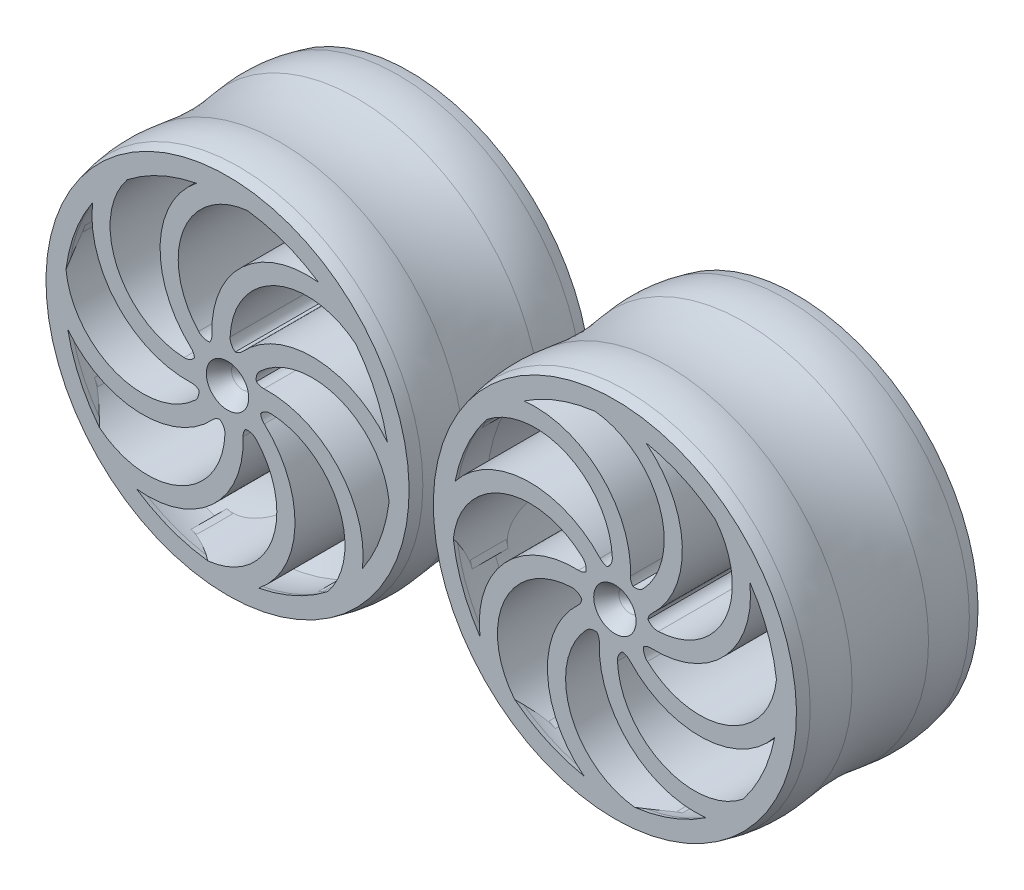
from build123d import *

# Parameters (mm, degrees)
SKETCH1_W                       = 15
SKETCH1_H                       = 2
BOSS_EXTRUDE1_REACH             = 25.052
BOSS_EXTRUDE1_DIRECTION_2_REACH = 25.052
FILLET3_R                       = 1
FILLET4_R                       = 10
CHAMFER4_SIZE                   = 1
CHAMFER4_SIZE2                  = 1.5
FILLET9_R                       = 1


with BuildPart() as part:
    # Sketch1 → Revolve1 (revolve)
    with BuildSketch(Plane(origin=(0, 0, 0), x_dir=(0, 0, -1), z_dir=(1, 0, 0)), mode=Mode.PRIVATE) as revolve1_sk:
        with Locations((0, 1.75)):
            Rectangle(SKETCH1_W, SKETCH1_H)
        with BuildLine():
            Line((-7.5, 15), (-7.5, 13.44651309))
            Line((-7.5, 13.44651309), (-7.109783666, 13.551645343))
            ThreePointArc((-7.109783666, 13.551645343), (-5.652360719, 13.835575666), (-4.169459433, 13.911086274))
            ThreePointArc((-4.169459433, 13.911086274), (0, 13.5), (4.169459433, 13.911086274))
            ThreePointArc((4.169459433, 13.911086274), (5.652360719, 13.835575666), (7.109783666, 13.551645343))
            Line((7.109783666, 13.551645343), (7.5, 13.44651309))
            Line((7.5, 13.44651309), (7.5, 15))
            ThreePointArc((7.5, 15), (5.765027363, 15.332764338), (4, 15.407199276))
            ThreePointArc((4, 15.407199276), (0, 15), (-4, 15.407199276))
            ThreePointArc((-4, 15.407199276), (-5.765027363, 15.332764338), (-7.5, 15))
        make_face()
    revolve(revolve1_sk.sketch.rotate(Axis((0, 0, 7.5), (0, 0, -1)), 180), axis=Axis((0, 0, 7.5), (0, 0, -1)))

    # Boss-Extrude1: up to this face of the body (flat: up to its plane)
    boss_extrude1_end = Plane(part.part.faces().sort_by_distance((0, 13.870777159, -7.5))[0])
    # Sketch3 → Boss-Extrude1 (add, up to the picked face)
    with BuildSketch(Plane(origin=(0, 0, 0), x_dir=(-1, 0, 0), z_dir=(0, 0, -1)), mode=Mode.PRIVATE) as boss_extrude1_sk1:
        with BuildLine():
            ThreePointArc((6.203693612, -12.270969219), (8.854913119, -10.51917362), (11.033195249, -8.205553156))
            ThreePointArc((11.033195249, -8.205553156), (8.865009868, -0.982514478), (1.618423571, 1.10561929))
            ThreePointArc((1.618423571, 1.10561929), (1.336532687, 0.612387367), (1.099671353, 0.096018403))
            ThreePointArc((1.099671353, 0.096018403), (1.519817571, -0.120882453), (1.926189179, -0.362607385))
            ThreePointArc((1.926189179, -0.362607385), (9.327117725, -4.426605369), (6.203693635, -12.270969265))
        make_face()
    boss_extrude1_tool1 = split(extrude(boss_extrude1_sk1.sketch, amount=BOSS_EXTRUDE1_REACH, mode=Mode.PRIVATE), bisect_by=boss_extrude1_end, keep=Keep.BOTH, mode=Mode.PRIVATE)
    # Sketch3 → Boss-Extrude1 (add, up to the picked face)
    with BuildSketch(Plane(origin=(0, 0, 0), x_dir=(-1, 0, 0), z_dir=(0, 0, -1)), mode=Mode.PRIVATE) as boss_extrude1_sk2:
        with BuildLine():
            ThreePointArc((13.063559368, -4.290211725), (13.577305353, -2.172390238), (13.75, 0))
            ThreePointArc((13.75, 0), (13.71341369, 1.00238963), (13.603849459, 1.999444899))
            ThreePointArc((13.603849459, 1.999444899), (6.963251243, 5.573765943), (0.362607385, 1.926189179))
            ThreePointArc((0.362607385, 1.926189179), (0.512048066, 1.378094586), (0.709689807, 0.845480334))
            ThreePointArc((0.709689807, 0.845480334), (1.160150113, 0.989196508), (1.618423571, 1.10561929))
            ThreePointArc((1.618423571, 1.10561929), (9.725350867, 3.465185518), (13.063559416, -4.290211741))
        make_face()
    boss_extrude1_tool2 = split(extrude(boss_extrude1_sk2.sketch, amount=BOSS_EXTRUDE1_REACH, mode=Mode.PRIVATE), bisect_by=boss_extrude1_end, keep=Keep.BOTH, mode=Mode.PRIVATE)
    # Sketch3 → Boss-Extrude1 (add, up to the picked face)
    with BuildSketch(Plane(origin=(0, 0, 0), x_dir=(-1, 0, 0), z_dir=(0, 0, -1)), mode=Mode.PRIVATE) as boss_extrude1_sk3:
        with BuildLine():
            ThreePointArc((0.362607385, 1.926189179), (4.426605369, 9.327117725), (12.270969265, 6.203693635))
            ThreePointArc((12.270969219, 6.203693612), (10.51917362, 8.854913119), (8.205553156, 11.033195249))
            ThreePointArc((8.205553156, 11.033195249), (0.982514478, 8.865009868), (-1.10561929, 1.618423571))
            ThreePointArc((-1.10561929, 1.618423571), (-0.612387367, 1.336532687), (-0.096018403, 1.099671353))
            ThreePointArc((-0.096018403, 1.099671353), (0.120882453, 1.519817571), (0.362607385, 1.926189179))
        make_face()
    boss_extrude1_tool3 = split(extrude(boss_extrude1_sk3.sketch, amount=BOSS_EXTRUDE1_REACH, mode=Mode.PRIVATE), bisect_by=boss_extrude1_end, keep=Keep.BOTH, mode=Mode.PRIVATE)
    # Sketch3 → Boss-Extrude1 (add, up to the picked face)
    with BuildSketch(Plane(origin=(0, 0, 0), x_dir=(-1, 0, 0), z_dir=(0, 0, -1)), mode=Mode.PRIVATE) as boss_extrude1_sk4:
        with BuildLine():
            ThreePointArc((-1.10561929, 1.618423571), (-3.465185518, 9.725350867), (4.290211741, 13.063559416))
            ThreePointArc((4.290211725, 13.063559368), (1.176809886, 13.699548113), (-1.999444899, 13.603849459))
            ThreePointArc((-1.999444899, 13.603849459), (-5.573765943, 6.963251243), (-1.926189179, 0.362607385))
            ThreePointArc((-1.926189179, 0.362607385), (-1.378094586, 0.512048066), (-0.845480334, 0.709689807))
            ThreePointArc((-0.845480334, 0.709689807), (-0.989196508, 1.160150113), (-1.10561929, 1.618423571))
        make_face()
    boss_extrude1_tool4 = split(extrude(boss_extrude1_sk4.sketch, amount=BOSS_EXTRUDE1_REACH, mode=Mode.PRIVATE), bisect_by=boss_extrude1_end, keep=Keep.BOTH, mode=Mode.PRIVATE)
    # Sketch3 → Boss-Extrude1 (add, up to the picked face)
    with BuildSketch(Plane(origin=(0, 0, 0), x_dir=(-1, 0, 0), z_dir=(0, 0, -1)), mode=Mode.PRIVATE) as boss_extrude1_sk5:
        with BuildLine():
            ThreePointArc((-1.926189179, 0.362607385), (-9.327117725, 4.426605369), (-6.203693635, 12.270969265))
            ThreePointArc((-6.203693612, 12.270969219), (-8.854913119, 10.51917362), (-11.033195249, 8.205553156))
            ThreePointArc((-11.033195249, 8.205553156), (-8.865009868, 0.982514478), (-1.618423571, -1.10561929))
            ThreePointArc((-1.618423571, -1.10561929), (-1.336532687, -0.612387367), (-1.099671353, -0.096018403))
            ThreePointArc((-1.099671353, -0.096018403), (-1.519817571, 0.120882453), (-1.926189179, 0.362607385))
        make_face()
    boss_extrude1_tool5 = split(extrude(boss_extrude1_sk5.sketch, amount=BOSS_EXTRUDE1_REACH, mode=Mode.PRIVATE), bisect_by=boss_extrude1_end, keep=Keep.BOTH, mode=Mode.PRIVATE)
    # Sketch3 → Boss-Extrude1 (add, up to the picked face)
    with BuildSketch(Plane(origin=(0, 0, 0), x_dir=(-1, 0, 0), z_dir=(0, 0, -1)), mode=Mode.PRIVATE) as boss_extrude1_sk6:
        with BuildLine():
            ThreePointArc((-1.618423571, -1.10561929), (-9.725350867, -3.465185518), (-13.063559416, 4.290211741))
            ThreePointArc((-13.063559368, 4.290211725), (-13.699548113, 1.176809886), (-13.603849459, -1.999444899))
            ThreePointArc((-13.603849459, -1.999444899), (-6.963251243, -5.573765943), (-0.362607385, -1.926189179))
            ThreePointArc((-0.362607385, -1.926189179), (-0.512048066, -1.378094586), (-0.709689807, -0.845480334))
            ThreePointArc((-0.709689807, -0.845480334), (-1.160150113, -0.989196508), (-1.618423571, -1.10561929))
        make_face()
    boss_extrude1_tool6 = split(extrude(boss_extrude1_sk6.sketch, amount=BOSS_EXTRUDE1_REACH, mode=Mode.PRIVATE), bisect_by=boss_extrude1_end, keep=Keep.BOTH, mode=Mode.PRIVATE)
    # Sketch3 → Boss-Extrude1 (add, up to the picked face)
    with BuildSketch(Plane(origin=(0, 0, 0), x_dir=(-1, 0, 0), z_dir=(0, 0, -1)), mode=Mode.PRIVATE) as boss_extrude1_sk7:
        with BuildLine():
            ThreePointArc((-12.270969219, -6.203693612), (-10.51917362, -8.854913119), (-8.205553156, -11.033195249))
            ThreePointArc((-8.205553156, -11.033195249), (-0.982514478, -8.865009868), (1.10561929, -1.618423571))
            ThreePointArc((1.10561929, -1.618423571), (0.612387367, -1.336532687), (0.096018403, -1.099671353))
            ThreePointArc((0.096018403, -1.099671353), (-0.120882453, -1.519817571), (-0.362607385, -1.926189179))
            ThreePointArc((-0.362607385, -1.926189179), (-4.426605369, -9.327117725), (-12.270969265, -6.203693635))
        make_face()
    boss_extrude1_tool7 = split(extrude(boss_extrude1_sk7.sketch, amount=BOSS_EXTRUDE1_REACH, mode=Mode.PRIVATE), bisect_by=boss_extrude1_end, keep=Keep.BOTH, mode=Mode.PRIVATE)
    # Sketch3 → Boss-Extrude1 (add, up to the picked face)
    with BuildSketch(Plane(origin=(0, 0, 0), x_dir=(-1, 0, 0), z_dir=(0, 0, -1)), mode=Mode.PRIVATE) as boss_extrude1_sk8:
        with BuildLine():
            ThreePointArc((-4.290211725, -13.063559368), (-1.176809886, -13.699548113), (1.999444899, -13.603849459))
            ThreePointArc((1.999444899, -13.603849459), (5.573765943, -6.963251243), (1.926189179, -0.362607385))
            ThreePointArc((1.926189179, -0.362607385), (1.378094586, -0.512048066), (0.845480334, -0.709689807))
            ThreePointArc((0.845480334, -0.709689807), (0.989196508, -1.160150113), (1.10561929, -1.618423571))
            ThreePointArc((1.10561929, -1.618423571), (3.465185518, -9.725350867), (-4.290211741, -13.063559416))
        make_face()
    boss_extrude1_tool8 = split(extrude(boss_extrude1_sk8.sketch, amount=BOSS_EXTRUDE1_REACH, mode=Mode.PRIVATE), bisect_by=boss_extrude1_end, keep=Keep.BOTH, mode=Mode.PRIVATE)
    add(boss_extrude1_tool1.solids().sort_by(Axis((-8.745993, -10.389783, 0), (0, 0, -1)))[0])
    add(boss_extrude1_tool2.solids().sort_by(Axis((-13.413104, -2.146118, 0), (0, 0, -1)))[0])
    add(boss_extrude1_tool3.solids().sort_by(Axis((0.027007, 1.60188, 0), (0, 0, -1)))[0])
    add(boss_extrude1_tool4.solids().sort_by(Axis((1.149065, 1.114385, 0), (0, 0, -1)))[0])
    add(boss_extrude1_tool5.solids().sort_by(Axis((1.60188, -0.027007, 0), (0, 0, -1)))[0])
    add(boss_extrude1_tool6.solids().sort_by(Axis((1.114385, -1.149065, 0), (0, 0, -1)))[0])
    add(boss_extrude1_tool7.solids().sort_by(Axis((10.389783, -8.745993, 0), (0, 0, -1)))[0])
    add(boss_extrude1_tool8.solids().sort_by(Axis((1.162578, -13.533869, 0), (0, 0, -1)))[0])

    # Boss-Extrude1 direction 2: up to this face of the body (flat: up to its plane)
    boss_extrude1_direction_2_end = Plane(part.part.faces().sort_by_distance((0, 14.575735931, 7.5))[0])
    # Sketch3 → Boss-Extrude1 direction 2 (add, up to the picked face)
    with BuildSketch(Plane(origin=(0, 0, 0), x_dir=(-1, 0, 0), z_dir=(0, 0, -1)), mode=Mode.PRIVATE) as boss_extrude1_direction_2_sk1:
        with BuildLine():
            ThreePointArc((6.203693612, -12.270969219), (8.854913119, -10.51917362), (11.033195249, -8.205553156))
            ThreePointArc((11.033195249, -8.205553156), (8.865009868, -0.982514478), (1.618423571, 1.10561929))
            ThreePointArc((1.618423571, 1.10561929), (1.336532687, 0.612387367), (1.099671353, 0.096018403))
            ThreePointArc((1.099671353, 0.096018403), (1.519817571, -0.120882453), (1.926189179, -0.362607385))
            ThreePointArc((1.926189179, -0.362607385), (9.327117725, -4.426605369), (6.203693635, -12.270969265))
        make_face()
    boss_extrude1_direction_2_tool1 = split(extrude(boss_extrude1_direction_2_sk1.sketch, amount=-BOSS_EXTRUDE1_DIRECTION_2_REACH, mode=Mode.PRIVATE), bisect_by=boss_extrude1_direction_2_end, keep=Keep.BOTH, mode=Mode.PRIVATE)
    # Sketch3 → Boss-Extrude1 direction 2 (add, up to the picked face)
    with BuildSketch(Plane(origin=(0, 0, 0), x_dir=(-1, 0, 0), z_dir=(0, 0, -1)), mode=Mode.PRIVATE) as boss_extrude1_direction_2_sk2:
        with BuildLine():
            ThreePointArc((13.063559368, -4.290211725), (13.577305353, -2.172390238), (13.75, 0))
            ThreePointArc((13.75, 0), (13.71341369, 1.00238963), (13.603849459, 1.999444899))
            ThreePointArc((13.603849459, 1.999444899), (6.963251243, 5.573765943), (0.362607385, 1.926189179))
            ThreePointArc((0.362607385, 1.926189179), (0.512048066, 1.378094586), (0.709689807, 0.845480334))
            ThreePointArc((0.709689807, 0.845480334), (1.160150113, 0.989196508), (1.618423571, 1.10561929))
            ThreePointArc((1.618423571, 1.10561929), (9.725350867, 3.465185518), (13.063559416, -4.290211741))
        make_face()
    boss_extrude1_direction_2_tool2 = split(extrude(boss_extrude1_direction_2_sk2.sketch, amount=-BOSS_EXTRUDE1_DIRECTION_2_REACH, mode=Mode.PRIVATE), bisect_by=boss_extrude1_direction_2_end, keep=Keep.BOTH, mode=Mode.PRIVATE)
    # Sketch3 → Boss-Extrude1 direction 2 (add, up to the picked face)
    with BuildSketch(Plane(origin=(0, 0, 0), x_dir=(-1, 0, 0), z_dir=(0, 0, -1)), mode=Mode.PRIVATE) as boss_extrude1_direction_2_sk3:
        with BuildLine():
            ThreePointArc((0.362607385, 1.926189179), (4.426605369, 9.327117725), (12.270969265, 6.203693635))
            ThreePointArc((12.270969219, 6.203693612), (10.51917362, 8.854913119), (8.205553156, 11.033195249))
            ThreePointArc((8.205553156, 11.033195249), (0.982514478, 8.865009868), (-1.10561929, 1.618423571))
            ThreePointArc((-1.10561929, 1.618423571), (-0.612387367, 1.336532687), (-0.096018403, 1.099671353))
            ThreePointArc((-0.096018403, 1.099671353), (0.120882453, 1.519817571), (0.362607385, 1.926189179))
        make_face()
    boss_extrude1_direction_2_tool3 = split(extrude(boss_extrude1_direction_2_sk3.sketch, amount=-BOSS_EXTRUDE1_DIRECTION_2_REACH, mode=Mode.PRIVATE), bisect_by=boss_extrude1_direction_2_end, keep=Keep.BOTH, mode=Mode.PRIVATE)
    # Sketch3 → Boss-Extrude1 direction 2 (add, up to the picked face)
    with BuildSketch(Plane(origin=(0, 0, 0), x_dir=(-1, 0, 0), z_dir=(0, 0, -1)), mode=Mode.PRIVATE) as boss_extrude1_direction_2_sk4:
        with BuildLine():
            ThreePointArc((-1.10561929, 1.618423571), (-3.465185518, 9.725350867), (4.290211741, 13.063559416))
            ThreePointArc((4.290211725, 13.063559368), (1.176809886, 13.699548113), (-1.999444899, 13.603849459))
            ThreePointArc((-1.999444899, 13.603849459), (-5.573765943, 6.963251243), (-1.926189179, 0.362607385))
            ThreePointArc((-1.926189179, 0.362607385), (-1.378094586, 0.512048066), (-0.845480334, 0.709689807))
            ThreePointArc((-0.845480334, 0.709689807), (-0.989196508, 1.160150113), (-1.10561929, 1.618423571))
        make_face()
    boss_extrude1_direction_2_tool4 = split(extrude(boss_extrude1_direction_2_sk4.sketch, amount=-BOSS_EXTRUDE1_DIRECTION_2_REACH, mode=Mode.PRIVATE), bisect_by=boss_extrude1_direction_2_end, keep=Keep.BOTH, mode=Mode.PRIVATE)
    # Sketch3 → Boss-Extrude1 direction 2 (add, up to the picked face)
    with BuildSketch(Plane(origin=(0, 0, 0), x_dir=(-1, 0, 0), z_dir=(0, 0, -1)), mode=Mode.PRIVATE) as boss_extrude1_direction_2_sk5:
        with BuildLine():
            ThreePointArc((-1.926189179, 0.362607385), (-9.327117725, 4.426605369), (-6.203693635, 12.270969265))
            ThreePointArc((-6.203693612, 12.270969219), (-8.854913119, 10.51917362), (-11.033195249, 8.205553156))
            ThreePointArc((-11.033195249, 8.205553156), (-8.865009868, 0.982514478), (-1.618423571, -1.10561929))
            ThreePointArc((-1.618423571, -1.10561929), (-1.336532687, -0.612387367), (-1.099671353, -0.096018403))
            ThreePointArc((-1.099671353, -0.096018403), (-1.519817571, 0.120882453), (-1.926189179, 0.362607385))
        make_face()
    boss_extrude1_direction_2_tool5 = split(extrude(boss_extrude1_direction_2_sk5.sketch, amount=-BOSS_EXTRUDE1_DIRECTION_2_REACH, mode=Mode.PRIVATE), bisect_by=boss_extrude1_direction_2_end, keep=Keep.BOTH, mode=Mode.PRIVATE)
    # Sketch3 → Boss-Extrude1 direction 2 (add, up to the picked face)
    with BuildSketch(Plane(origin=(0, 0, 0), x_dir=(-1, 0, 0), z_dir=(0, 0, -1)), mode=Mode.PRIVATE) as boss_extrude1_direction_2_sk6:
        with BuildLine():
            ThreePointArc((-1.618423571, -1.10561929), (-9.725350867, -3.465185518), (-13.063559416, 4.290211741))
            ThreePointArc((-13.063559368, 4.290211725), (-13.699548113, 1.176809886), (-13.603849459, -1.999444899))
            ThreePointArc((-13.603849459, -1.999444899), (-6.963251243, -5.573765943), (-0.362607385, -1.926189179))
            ThreePointArc((-0.362607385, -1.926189179), (-0.512048066, -1.378094586), (-0.709689807, -0.845480334))
            ThreePointArc((-0.709689807, -0.845480334), (-1.160150113, -0.989196508), (-1.618423571, -1.10561929))
        make_face()
    boss_extrude1_direction_2_tool6 = split(extrude(boss_extrude1_direction_2_sk6.sketch, amount=-BOSS_EXTRUDE1_DIRECTION_2_REACH, mode=Mode.PRIVATE), bisect_by=boss_extrude1_direction_2_end, keep=Keep.BOTH, mode=Mode.PRIVATE)
    # Sketch3 → Boss-Extrude1 direction 2 (add, up to the picked face)
    with BuildSketch(Plane(origin=(0, 0, 0), x_dir=(-1, 0, 0), z_dir=(0, 0, -1)), mode=Mode.PRIVATE) as boss_extrude1_direction_2_sk7:
        with BuildLine():
            ThreePointArc((-12.270969219, -6.203693612), (-10.51917362, -8.854913119), (-8.205553156, -11.033195249))
            ThreePointArc((-8.205553156, -11.033195249), (-0.982514478, -8.865009868), (1.10561929, -1.618423571))
            ThreePointArc((1.10561929, -1.618423571), (0.612387367, -1.336532687), (0.096018403, -1.099671353))
            ThreePointArc((0.096018403, -1.099671353), (-0.120882453, -1.519817571), (-0.362607385, -1.926189179))
            ThreePointArc((-0.362607385, -1.926189179), (-4.426605369, -9.327117725), (-12.270969265, -6.203693635))
        make_face()
    boss_extrude1_direction_2_tool7 = split(extrude(boss_extrude1_direction_2_sk7.sketch, amount=-BOSS_EXTRUDE1_DIRECTION_2_REACH, mode=Mode.PRIVATE), bisect_by=boss_extrude1_direction_2_end, keep=Keep.BOTH, mode=Mode.PRIVATE)
    # Sketch3 → Boss-Extrude1 direction 2 (add, up to the picked face)
    with BuildSketch(Plane(origin=(0, 0, 0), x_dir=(-1, 0, 0), z_dir=(0, 0, -1)), mode=Mode.PRIVATE) as boss_extrude1_direction_2_sk8:
        with BuildLine():
            ThreePointArc((-4.290211725, -13.063559368), (-1.176809886, -13.699548113), (1.999444899, -13.603849459))
            ThreePointArc((1.999444899, -13.603849459), (5.573765943, -6.963251243), (1.926189179, -0.362607385))
            ThreePointArc((1.926189179, -0.362607385), (1.378094586, -0.512048066), (0.845480334, -0.709689807))
            ThreePointArc((0.845480334, -0.709689807), (0.989196508, -1.160150113), (1.10561929, -1.618423571))
            ThreePointArc((1.10561929, -1.618423571), (3.465185518, -9.725350867), (-4.290211741, -13.063559416))
        make_face()
    boss_extrude1_direction_2_tool8 = split(extrude(boss_extrude1_direction_2_sk8.sketch, amount=-BOSS_EXTRUDE1_DIRECTION_2_REACH, mode=Mode.PRIVATE), bisect_by=boss_extrude1_direction_2_end, keep=Keep.BOTH, mode=Mode.PRIVATE)
    add(boss_extrude1_direction_2_tool1.solids().sort_by(Axis((-8.745993, -10.389783, 0), (0, 0, 1)))[0])
    add(boss_extrude1_direction_2_tool2.solids().sort_by(Axis((-13.413104, -2.146118, 0), (0, 0, 1)))[0])
    add(boss_extrude1_direction_2_tool3.solids().sort_by(Axis((0.027007, 1.60188, 0), (0, 0, 1)))[0])
    add(boss_extrude1_direction_2_tool4.solids().sort_by(Axis((1.149065, 1.114385, 0), (0, 0, 1)))[0])
    add(boss_extrude1_direction_2_tool5.solids().sort_by(Axis((1.60188, -0.027007, 0), (0, 0, 1)))[0])
    add(boss_extrude1_direction_2_tool6.solids().sort_by(Axis((1.114385, -1.149065, 0), (0, 0, 1)))[0])
    add(boss_extrude1_direction_2_tool7.solids().sort_by(Axis((10.389783, -8.745993, 0), (0, 0, 1)))[0])
    add(boss_extrude1_direction_2_tool8.solids().sort_by(Axis((1.162578, -13.533869, 0), (0, 0, 1)))[0])

    # Fillet3
    # the kernel refuses this fillet: 1 mm, written as the material it adds along each edge
    with BuildSketch(Plane(origin=(-2.740041589, -0.233820642, -7.5), x_dir=(-0.9996743808417937, 0.02551729391170806, 0), z_dir=(0, 0, 1)), Plane(origin=(2.102838149, -1.772165827, -7.5), x_dir=(0.6888330821092182, -0.7249199852341741, 0), z_dir=(0, 0, 1)), Plane(origin=(2.740041589, 0.233820642, -7.5), x_dir=(0.9996743808417938, -0.02551729391170237, 0), z_dir=(0, 0, 1)), Plane(origin=(1.772165827, 2.102838149, -7.5), x_dir=(0.724919985234174, 0.6888330821092181, 0), z_dir=(0, 0, 1)), Plane(origin=(-0.233820642, 2.740041589, -7.5), x_dir=(0.025517293911697426, 0.9996743808417939, 0), z_dir=(0, 0, 1)), Plane(origin=(-2.102838149, 1.772165827, -7.5), x_dir=(-0.6888330821092128, 0.7249199852341792, 0), z_dir=(0, 0, 1))) as fillet3_piece_1:
        with BuildLine():
            CenterArc((0.783742528, 0.997772976), FILLET3_R, 200.3069601, 73.517593378)
            ThreePointArc((-0.154104255, 0.650723395), (-0.057198798, 0.330063361), (0, 0))
            ThreePointArc((0, 0), (0.42522201, -0.01419728), (0.850444019, 0))
        make_face()
    extrude(amount=15)
    with BuildSketch(Plane(origin=(-2.61403089, -0.85401552, 7.5), x_dir=(-0.22093605147892362, 0.9752882964318307, 0), z_dir=(0, 0, -1)), Plane(origin=(-1.244518803, -2.452279134, 7.5), x_dir=(-0.8458583482281762, 0.533407587809455, 0), z_dir=(0, 0, -1)), Plane(origin=(2.452279134, -1.244518803, 7.5), x_dir=(-0.5334075878094503, -0.8458583482281792, 0), z_dir=(0, 0, -1)), Plane(origin=(2.61403089, 0.85401552, 7.5), x_dir=(0.2209360514789292, -0.9752882964318292, 0), z_dir=(0, 0, -1)), Plane(origin=(1.244518803, 2.452279134, 7.5), x_dir=(0.8458583482281806, -0.533407587809448, 0), z_dir=(0, 0, -1)), Plane(origin=(-0.85401552, 2.61403089, 7.5), x_dir=(0.9752882964318317, 0.22093605147891993, 0), z_dir=(0, 0, -1)), Plane(origin=(-2.452279134, 1.244518803, 7.5), x_dir=(0.5334075878094564, 0.8458583482281753, 0), z_dir=(0, 0, -1))) as fillet3_piece_2:
        with BuildLine():
            CenterArc((0.603619967, -0.995678745), FILLET3_R, 95.328427612, 54.72757285)
            ThreePointArc((-0.262893719, -0.496525431), (-0.127017484, -0.250607923), (0, 0))
            ThreePointArc((0, 0), (0.255377678, -0.01188345), (0.510755357, 0))
        make_face()
    extrude(amount=15)
    with BuildSketch(Plane(origin=(-1.772165827, -2.102838149, 7.5), x_dir=(-0.7249199852341777, -0.6888330821092145, 0), z_dir=(0, 0, -1))) as fillet3_piece_3:
        with BuildLine():
            CenterArc((0.783742528, -0.997772976), FILLET3_R, 86.175446523, 73.517593378)
            ThreePointArc((-0.154104255, -0.650723395), (-0.057198798, -0.330063361), (0, 0))
            ThreePointArc((0, 0), (0.42522201, 0.01419728), (0.850444019, 0))
        make_face()
    extrude(amount=15)
    with BuildSketch(Plane(origin=(0.233820642, -2.740041589, -7.5), x_dir=(0.9786486325562687, 0.20554039504619376, 0), z_dir=(0, 0, 1))) as fillet3_piece_4:
        with BuildLine():
            CenterArc((0.79030777, -0.992580924), FILLET3_R, 96.983633061, 73.517593378)
            ThreePointArc((-0.195981365, -0.82755443), (-0.111805844, -0.41050551), (0, 0))
            ThreePointArc((0, 0), (0.334360979, -0.020402459), (0.668721959, 0))
        make_face()
    extrude(amount=15)
    with BuildSketch(Plane(origin=(0.85401552, -2.61403089, -7.5), x_dir=(-0.9752882964318297, -0.2209360514789276, 0), z_dir=(0, 0, 1))) as fillet3_piece_5:
        with BuildLine():
            CenterArc((0.603619967, 0.995678745), FILLET3_R, 209.943999538, 54.72757285)
            ThreePointArc((-0.262893719, 0.496525431), (-0.127017484, 0.250607923), (0, 0))
            ThreePointArc((0, 0), (0.255377678, 0.01188345), (0.510755357, 0))
        make_face()
    extrude(amount=15)

    # Fillet4
    fillet4_edges = [part.edges().sort_by_distance(p)[0] for p in [
        (0, 15.407199276, 4),
        (0, 15.407199276, -4),
    ]]
    fillet(fillet4_edges, radius=FILLET4_R)

    # Chamfer4
    chamfer4_edges = [part.edges().sort_by_distance(p)[0] for p in [
        (0, 0.75, 7.5),
    ]]
    chamfer4_side = [part.faces().sort_by_distance(p)[0] for p in [
        (1.15435077, -2.461131519, 7.5),
    ]]
    chamfer(chamfer4_edges, length=CHAMFER4_SIZE, length2=CHAMFER4_SIZE2, reference=chamfer4_side[0])

    # Fillet9
    fillet9_edges = [part.edges().sort_by_distance(p)[0] for p in [
        (0, 0.75, 6),
    ]]
    fillet(fillet9_edges, radius=FILLET9_R)


with BuildPart() as body_2:
    # Mirror2: mirrored copy
    add(part.part.mirror(Plane(origin=(-16, 0, 0), x_dir=(0, 0, 1), z_dir=(1, 0, 0))))


solid = Compound([part.part, body_2.part])
